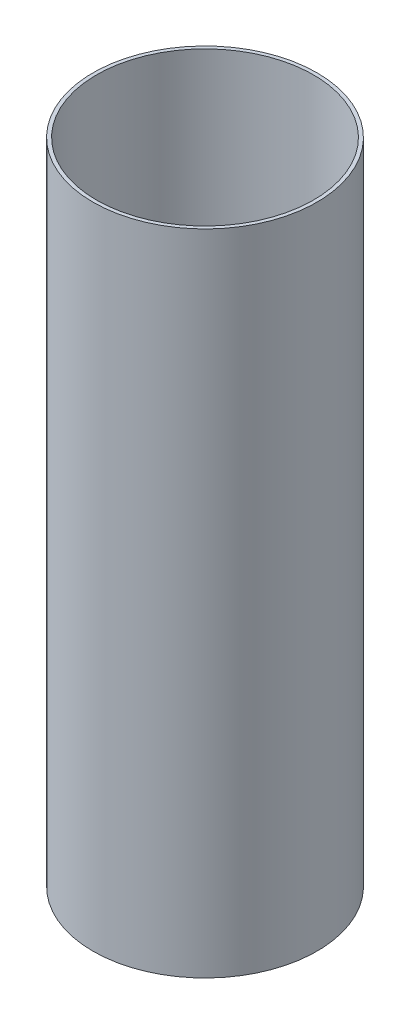
from build123d import *

# Parameters (mm, degrees)
SKETCH1_R           = 19
SKETCH1_R_2         = 18.4
BOSS_EXTRUDE1_DEPTH = 55


with BuildPart() as part:
    # Sketch1 → Boss-Extrude1 (new, symmetric)
    with BuildSketch(Plane(origin=(0, 0, 0), x_dir=(1, 0, 0), z_dir=(0, 1, 0))):
        Circle(SKETCH1_R)
        Circle(SKETCH1_R_2, mode=Mode.SUBTRACT)
    extrude(amount=BOSS_EXTRUDE1_DEPTH, both=True)


solid = part.part
